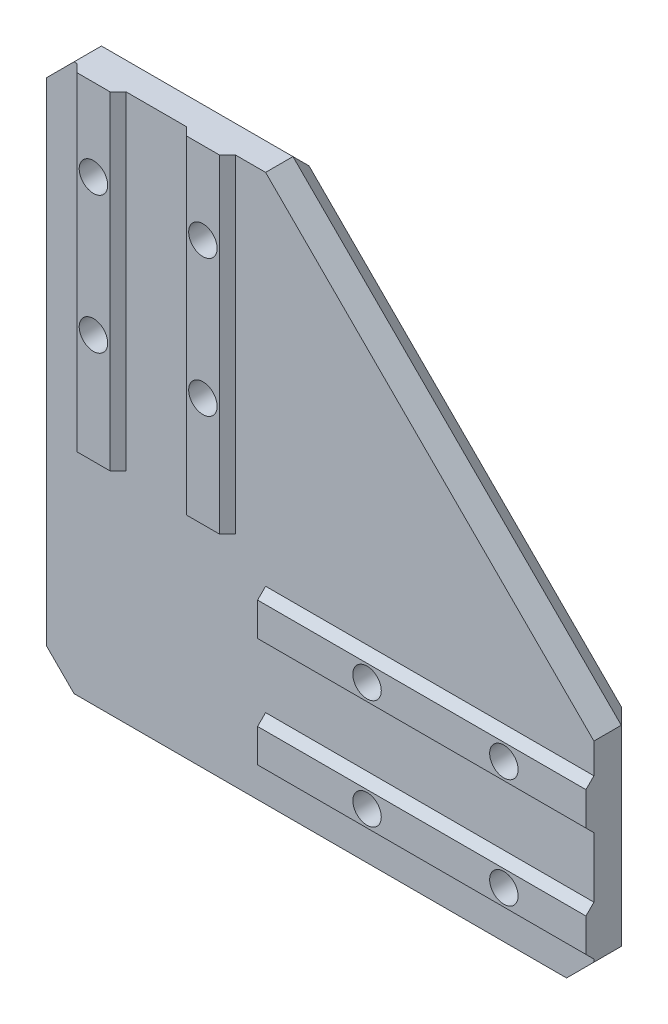
from build123d import *

# Parameters (mm, degrees)
BOSS_EXTRUDE1_DEPTH     = 10
SKETCH2_R               = 2.6
CUT_EXTRUDE1_DEPTH      = 142.774468788
BOSS_EXTRUDE3_START     = 10
SKETCH3_W               = 60
SKETCH3_H               = 9
SKETCH3_W_2             = 9
SKETCH3_H_2             = 60
BOSS_EXTRUDE3_DEPTH     = 1.46
CUT_EXTRUDE2_DEPTH      = 142.884923794
CUT_EXTRUDE2_DEPTH_BACK = 142.884923794
SKETCH2_2_R             = 2.6
CHAMFER1_SIZE           = 1.46
SKETCH4_R               = 4.5
CUT_EXTRUDE3_DEPTH      = 5
CHAMFER2_SIZE           = 5


with BuildPart() as part:
    # Sketch1 → Boss-Extrude1 (new body)
    with BuildSketch(Plane.XY):
        Polygon((0, 0), (100, 0), (100, 40), (40, 100), (0, 100), align=None)
    extrude(amount=BOSS_EXTRUDE1_DEPTH)

    # Sketch2 → Cut-Extrude1 (cut, through all)
    with BuildSketch(Plane.XY):
        with Locations((10, 85)):
            Circle(SKETCH2_R)
        with Locations((30, 85)):
            Circle(SKETCH2_R)
        with Locations((10, 60)):
            Circle(SKETCH2_R)
        with Locations((30, 60)):
            Circle(SKETCH2_R)
        with Locations((85, 30)):
            Circle(SKETCH2_R)
        with Locations((85, 10)):
            Circle(SKETCH2_R)
        with Locations((60, 10)):
            Circle(SKETCH2_R)
        with Locations((60, 30)):
            Circle(SKETCH2_R)
    extrude(amount=CUT_EXTRUDE1_DEPTH, mode=Mode.SUBTRACT)

    # Sketch3 → Boss-Extrude3 (add)
    with BuildSketch(Plane.XY.offset(BOSS_EXTRUDE3_START)):
        with Locations((70, 30)):
            Rectangle(SKETCH3_W, SKETCH3_H)
        with Locations((70, 10)):
            Rectangle(SKETCH3_W, SKETCH3_H)
        with Locations((10, 70)):
            Rectangle(SKETCH3_W_2, SKETCH3_H_2)
        with Locations((30, 70)):
            Rectangle(SKETCH3_W_2, SKETCH3_H_2)
    extrude(amount=BOSS_EXTRUDE3_DEPTH)

    # Sketch2<2> → Cut-Extrude2 (cut, two sides: drawn at the far end of the back side and taken through both)
    with BuildSketch(Plane.XY.offset(-CUT_EXTRUDE2_DEPTH_BACK)):
        with Locations((10, 85)):
            Circle(SKETCH2_2_R)
        with Locations((30, 85)):
            Circle(SKETCH2_2_R)
        with Locations((10, 60)):
            Circle(SKETCH2_2_R)
        with Locations((30, 60)):
            Circle(SKETCH2_2_R)
        with Locations((85, 30)):
            Circle(SKETCH2_2_R)
        with Locations((85, 10)):
            Circle(SKETCH2_2_R)
        with Locations((60, 10)):
            Circle(SKETCH2_2_R)
        with Locations((60, 30)):
            Circle(SKETCH2_2_R)
    extrude(amount=CUT_EXTRUDE2_DEPTH + CUT_EXTRUDE2_DEPTH_BACK, mode=Mode.SUBTRACT)

    # Chamfer1
    chamfer1_edges = [part.edges().sort_by_distance(p)[0] for p in [
        (14.5, 70, 11.46),
        (5.5, 70, 11.46),
        (25.5, 70, 11.46),
        (34.5, 70, 11.46),
        (70, 5.5, 11.46),
        (70, 14.5, 11.46),
        (70, 25.5, 11.46),
        (70, 34.5, 11.46),
    ]]
    chamfer(chamfer1_edges, length=CHAMFER1_SIZE - 0.0001)  # a hair under: the kernel refuses the full size

    # Sketch4 → Cut-Extrude3 (cut)
    with BuildSketch(Plane.XY):
        with Locations((10, 85)):
            Circle(SKETCH4_R)
        with Locations((30, 85)):
            Circle(SKETCH4_R)
        with Locations((30, 60)):
            Circle(SKETCH4_R)
        with Locations((10, 60)):
            Circle(SKETCH4_R)
        with Locations((60, 30)):
            Circle(SKETCH4_R)
        with Locations((85, 30)):
            Circle(SKETCH4_R)
        with Locations((85, 10)):
            Circle(SKETCH4_R)
        with Locations((60, 10)):
            Circle(SKETCH4_R)
    extrude(amount=CUT_EXTRUDE3_DEPTH, mode=Mode.SUBTRACT)

    # Chamfer2
    chamfer2_edges = [part.edges().sort_by_distance(p)[0] for p in [
        (20, 100, 0),
        (70, 70, 0),
        (100, 20, 0),
        (50, 0, 0),
        (0, 50, 0),
        (0, 100, 5),
        (100, 0, 5),
        (0, 0, 5),
    ]]
    chamfer(chamfer2_edges, length=CHAMFER2_SIZE)


solid = part.part
